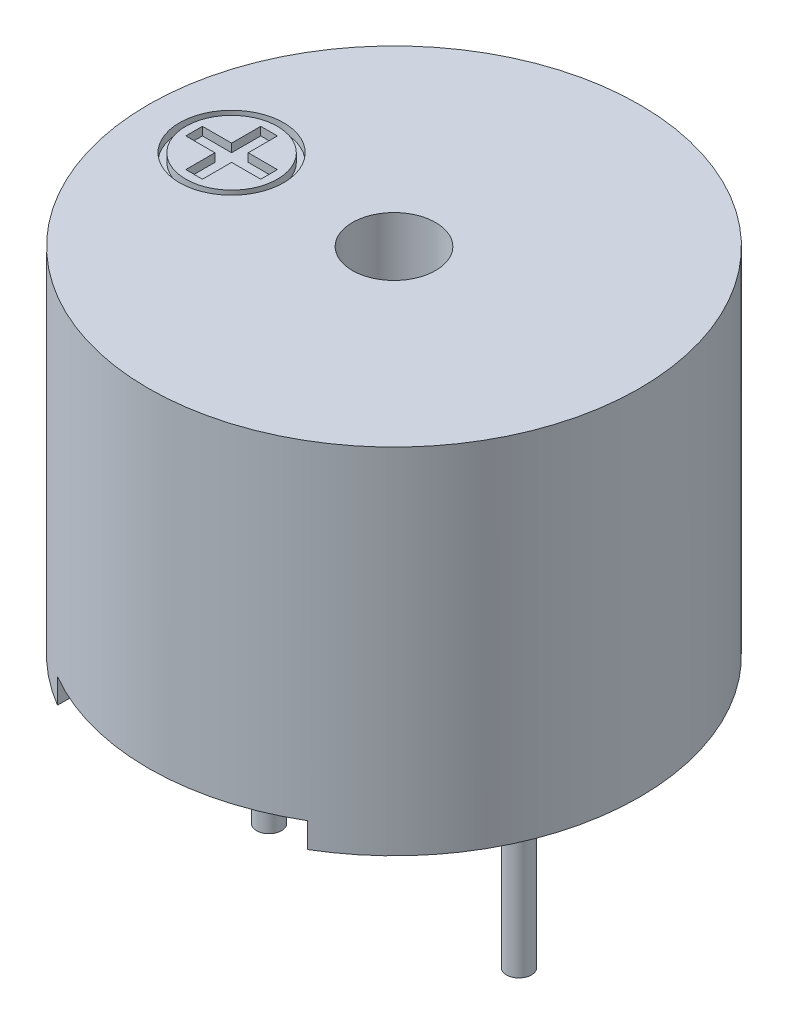
from build123d import *

# Parameters (mm, degrees)
SKETCH1_R           = 5.9
BOSS_EXTRUDE1_DEPTH = 8.5
CUT_EXTRUDE1_DEPTH  = 0.6
SKETCH3_R           = 5
CUT_EXTRUDE2_DEPTH  = 2
SKETCH4_R           = 1
CUT_EXTRUDE3_DEPTH  = 3
SKETCH5_R           = 1.25
SKETCH5_R_2         = 1.1
CUT_EXTRUDE4_DEPTH  = 0.2
SKETCH6_R           = 0.3
BOSS_EXTRUDE2_DEPTH = 7


with BuildPart() as part:
    # Sketch1 → Boss-Extrude1 (new body)
    with BuildSketch(Plane(origin=(0, 0, 0), x_dir=(1, 0, 0), z_dir=(0, 1, 0))):
        Circle(SKETCH1_R)
    extrude(amount=BOSS_EXTRUDE1_DEPTH)

    # Sketch2 → Cut-Extrude1 (cut)
    with BuildSketch(Plane.XZ):
        with BuildLine():
            Line((-3, 5.080354318), (-3, -5.080354318))
            ThreePointArc((-3, -5.080354318), (0, -5.9), (3, -5.080354318))
            Line((3, -5.080354318), (3, 5.080354318))
            ThreePointArc((3, 5.080354318), (0, 5.9), (-3, 5.080354318))
        make_face()
    extrude(amount=-CUT_EXTRUDE1_DEPTH, mode=Mode.SUBTRACT)

    # Sketch3 → Cut-Extrude2 (cut)
    with BuildSketch(Plane.XZ):
        Circle(SKETCH3_R)
    extrude(amount=-CUT_EXTRUDE2_DEPTH, mode=Mode.SUBTRACT)

    # Sketch4 → Cut-Extrude3 (cut)
    with BuildSketch(Plane(origin=(0, 8.5, 0), x_dir=(1, 0, 0), z_dir=(0, 1, 0))):
        Circle(SKETCH4_R)
    extrude(amount=-CUT_EXTRUDE3_DEPTH, mode=Mode.SUBTRACT)

    # Sketch5 → Cut-Extrude4 (cut)
    # profile 1 of 2: a face of its own
    with BuildSketch(Plane(origin=(0, 8.5, 0), x_dir=(1, 0, 0), z_dir=(0, 1, 0))):
        with Locations((-3.9, 0)):
            Circle(SKETCH5_R)
        with Locations((-3.9, 0)):
            Circle(SKETCH5_R_2, mode=Mode.SUBTRACT)
    # profile 2 of 2: a face of its own
    with BuildSketch(Plane(origin=(0, 8.5, 0), x_dir=(1, 0, 0), z_dir=(0, 1, 0))):
        Polygon((-4.1, 0.9), (-4.1, 0.2), (-4.8, 0.2), (-4.8, -0.2), (-4.1, -0.2), (-4.1, -0.9), (-3.7, -0.9), (-3.7, -0.2), (-3, -0.2), (-3, 0.2), (-3.7, 0.2), (-3.7, 0.9), align=None)
    extrude(amount=-CUT_EXTRUDE4_DEPTH, mode=Mode.SUBTRACT)

    # Sketch6 → Boss-Extrude2 (add)
    with BuildSketch(Plane.XZ.offset(-2)):
        with Locations((-3, 0)):
            Circle(SKETCH6_R)
        with Locations((3, 0)):
            Circle(SKETCH6_R)
    extrude(amount=BOSS_EXTRUDE2_DEPTH)


solid = part.part
